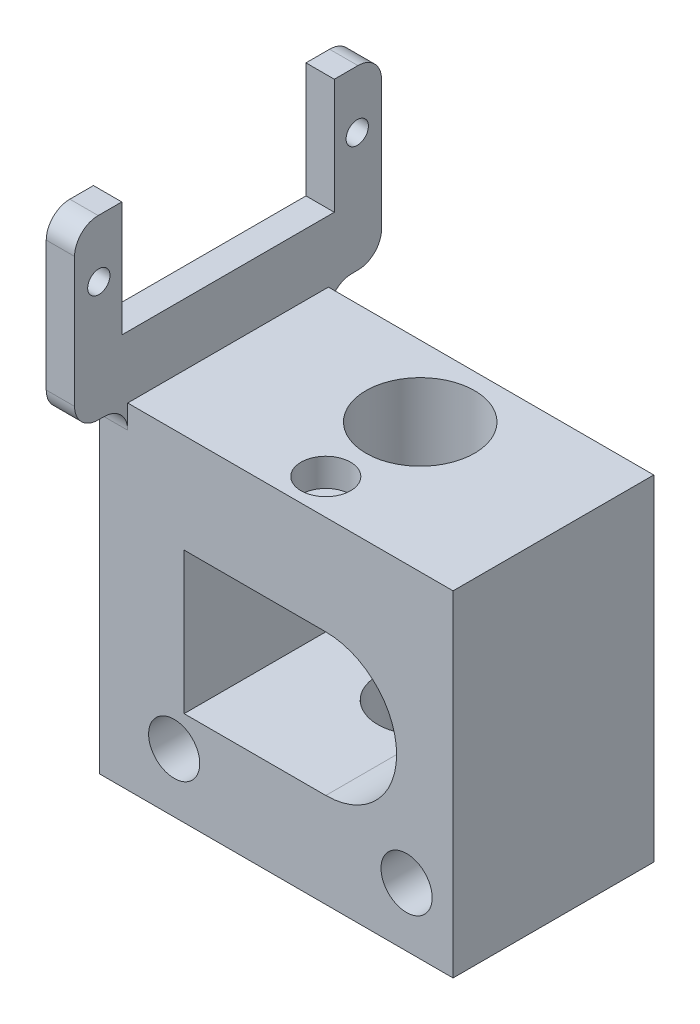
from build123d import *

# Parameters (mm, degrees)
SKETCH2_W            = 35
SKETCH2_H            = 36.068
BOSS_EXTRUDE1_DEPTH  = 21.59
M5_CLEARANCE_HOLE1_D = 5.5
SKETCH13_W           = 22.86
SKETCH13_H           = 15.24
CUT_EXTRUDE3_DEPTH   = 55.699439887
CUT_EXTRUDE1_REACH   = 56.699
SKETCH5_R            = 5.842
BOSS_EXTRUDE2_DEPTH  = 3.048
M2_CLEARANCE_HOLE1_D = 2.4
FILLET2_R            = 2.54
SKETCH11_R           = 2.667
CUT_EXTRUDE2_DEPTH   = 3
SKETCH14_R           = 4.572
CUT_EXTRUDE4_DEPTH   = 64.180572876
FILLET3_R            = 7.62


with BuildPart() as part:
    # Sketch2 → Boss-Extrude1 (new body)
    with BuildSketch(Plane.XY):
        with Locations((17.5, 18.034)):
            Rectangle(SKETCH2_W, SKETCH2_H)
    extrude(amount=BOSS_EXTRUDE1_DEPTH)

    # M5 Clearance Hole1 (through all)
    with Locations(Plane(origin=(0, 0, 0), x_dir=(1, 0, 0), z_dir=(0, 0, -1))):
        with Locations((5, -6.35), (30, -6.35)):
            Hole(M5_CLEARANCE_HOLE1_D / 2)

    # Sketch13 → Cut-Extrude3 (cut, through all)
    with BuildSketch(Plane.XY.offset(21.59)):
        with Locations((17.5, 17.78)):
            Rectangle(SKETCH13_W, SKETCH13_H)
    extrude(amount=-CUT_EXTRUDE3_DEPTH, mode=Mode.SUBTRACT)

    # Sketch5 → Cut-Extrude1 (cut, up to next)
    with BuildSketch(Plane(origin=(0, 36.068, 0), x_dir=(1, 0, 0), z_dir=(0, 1, 0)), mode=Mode.PRIVATE) as cut_extrude1_sk1:
        with Locations(Location((17.5, -7.62, 0), (0, 0, 270))):
            Circle(SKETCH5_R)
    cut_extrude1_tool1 = extrude(cut_extrude1_sk1.sketch, amount=-CUT_EXTRUDE1_REACH, mode=Mode.PRIVATE) & part.part
    add(cut_extrude1_tool1.solids().sort_by_distance((17.5, 36.068, 7.62))[0], mode=Mode.SUBTRACT)

    # Sketch7 → Boss-Extrude2 (add)
    with BuildSketch(Plane.ZY):
        Polygon((-5.715, 55.118), (-5.715, 36.068), (0, 36.068), (0, 0), (21.59, 0), (21.59, 36.068), (27.305, 36.068), (27.305, 55.118), (22.225, 55.118), (22.225, 42.7228), (-0.635, 42.7228), (-0.635, 55.118), align=None)
    extrude(amount=BOSS_EXTRUDE2_DEPTH)

    # M2 Clearance Hole1 (through all)
    with Locations(Plane.ZY.offset(3.048)):
        with Locations((-3.10388, 48.9204), (24.69388, 48.9204)):
            Hole(M2_CLEARANCE_HOLE1_D / 2)

    # Fillet2
    fillet2_edges = [part.edges().sort_by_distance(p)[0] for p in [
        (-1.524, 55.118, -5.715),
        (-1.524, 36.068, -5.715),
        (-1.524, 36.068, 0),
        (-1.524, 36.068, 21.59),
        (-1.524, 36.068, 27.305),
        (-1.524, 55.118, 27.305),
    ]]
    fillet(fillet2_edges, radius=FILLET2_R)

    # Sketch11 → Cut-Extrude2 (cut)
    with BuildSketch(Plane(origin=(0, 36.068, 0), x_dir=(1, 0, 0), z_dir=(0, 1, 0))):
        with Locations(Location((17.5, -17.78, 0), (0, 0, 270))):
            Circle(SKETCH11_R)
    extrude(amount=-CUT_EXTRUDE2_DEPTH, mode=Mode.SUBTRACT)

    # Sketch14 → Cut-Extrude4 (cut, through all)
    with BuildSketch(Plane(origin=(0, 10.16, 0), x_dir=(1, 0, 0), z_dir=(0, 1, 0))):
        with Locations(Location((17.5, -7.62, 0), (0, 0, 270))):
            Circle(SKETCH14_R)
    extrude(amount=-CUT_EXTRUDE4_DEPTH, mode=Mode.SUBTRACT)

    # Fillet3
    # the kernel refuses this fillet: 7.62 mm, written as the material it adds along each edge
    with BuildSketch(Plane(origin=(28.93, 25.4, 21.59), x_dir=(-1, 0, 0), z_dir=(0, 0, -1))) as fillet3_piece_1_section:
        with BuildLine():
            CenterArc((FILLET3_R, -FILLET3_R), FILLET3_R, 90, 90)
            Line((0, -FILLET3_R), (0, 0))
            Line((0, 0), (FILLET3_R, 0))
        make_face()
    fillet3_piece_1 = extrude(amount=21.59, mode=Mode.PRIVATE)
    fillet3_piece_1 = fillet3_piece_1 - Plane(origin=(17.5, 23.659865562, 7.62), x_dir=(0, 0, 1), z_dir=(0, 1, 0)) * Cylinder(5.842, 74, mode=Mode.PRIVATE)
    add(fillet3_piece_1)
    with BuildSketch(Plane(origin=(28.93, 10.16, 21.59), x_dir=(0, 1, 0), z_dir=(0, 0, -1))) as fillet3_piece_2_section:
        with BuildLine():
            CenterArc((FILLET3_R, -FILLET3_R), FILLET3_R, 90, 90)
            Line((0, -FILLET3_R), (0, 0))
            Line((0, 0), (FILLET3_R, 0))
        make_face()
    fillet3_piece_2 = extrude(amount=21.59, mode=Mode.PRIVATE)
    fillet3_piece_2 = fillet3_piece_2 - Plane(origin=(17.5, 11.887502218, 7.62), x_dir=(0, 0, 1), z_dir=(0, 1, 0)) * Cylinder(4.572, 74, mode=Mode.PRIVATE)
    add(fillet3_piece_2)


solid = part.part
